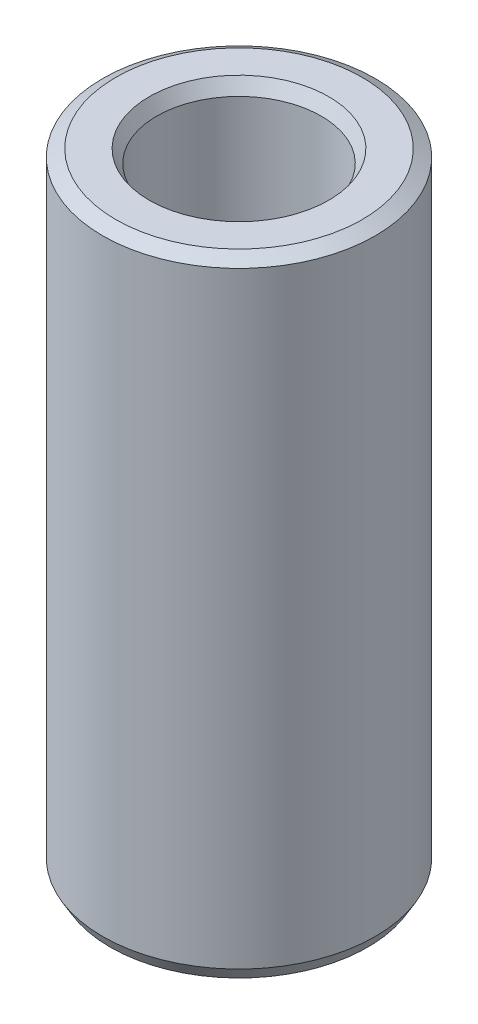
from build123d import *
from OCP.BRepFilletAPI import BRepFilletAPI_MakeChamfer

# Parameters (mm, degrees)
SKETCH1_R           = 50
BOSS_EXTRUDE1_DEPTH = 230.191908905
SKETCH2_R           = 30.174089752
CUT_EXTRUDE1_DEPTH  = 241.807630538
CHAMFER1_SIZE       = 2.76422924
CHAMFER1_SIZE2      = 4.787785487


with BuildPart() as part:
    # Sketch1 → Boss-Extrude1 (new body)
    with BuildSketch(Plane(origin=(0, 0, 0), x_dir=(1, 0, 0), z_dir=(0, 1, 0))):
        Circle(SKETCH1_R)
    extrude(amount=BOSS_EXTRUDE1_DEPTH)

    # Sketch2 → Cut-Extrude1 (cut, through all)
    with BuildSketch(Plane(origin=(0, 0, 0), x_dir=(1, 0, 0), z_dir=(0, 1, 0))):
        Circle(SKETCH2_R)
    extrude(amount=CUT_EXTRUDE1_DEPTH, mode=Mode.SUBTRACT)

    # Chamfer1: one chamfer whose edges measure the first distance from different faces: ONE call of the kernel's chamfer builder (chamfer() names one face for all edges)
    chamfer1_edges_1 = [part.edges().sort_by_distance(p)[0] for p in [
        (-30.174089752, 230.191908905, 0),
    ]]
    chamfer1_side_1 = [part.faces().sort_by_distance(p)[0] for p in [
        (-48.585786438, 230.191908905, 0),
    ]]
    chamfer1_edges_2 = [part.edges().sort_by_distance(p)[0] for p in [
        (-30.174089752, 0, 0),
    ]]
    chamfer1_side_2 = [part.faces().sort_by_distance(p)[0] for p in [
        (-30.174089752, 115.095954452, 0),
    ]]
    chamfer1_edges_3 = [part.edges().sort_by_distance(p)[0] for p in [
        (-50, 0, 0),
    ]]
    chamfer1_side_3 = [part.faces().sort_by_distance(p)[0] for p in [
        (-48.585786438, 0, 0),
    ]]
    chamfer1_edges_4 = [part.edges().sort_by_distance(p)[0] for p in [
        (-50, 230.191908905, 0),
    ]]
    chamfer1_side_4 = [part.faces().sort_by_distance(p)[0] for p in [
        (-50, 115.095954452, 0),
    ]]
    chamfer1 = BRepFilletAPI_MakeChamfer(part.part.solid().wrapped)
    for e in chamfer1_edges_1:
        chamfer1.Add(CHAMFER1_SIZE, CHAMFER1_SIZE2, e.wrapped, chamfer1_side_1[0].wrapped)  # the first distance lies on this face
    for e in chamfer1_edges_2:
        chamfer1.Add(CHAMFER1_SIZE, CHAMFER1_SIZE2, e.wrapped, chamfer1_side_2[0].wrapped)  # the first distance lies on this face
    for e in chamfer1_edges_3:
        chamfer1.Add(CHAMFER1_SIZE, CHAMFER1_SIZE2, e.wrapped, chamfer1_side_3[0].wrapped)  # the first distance lies on this face
    for e in chamfer1_edges_4:
        chamfer1.Add(CHAMFER1_SIZE, CHAMFER1_SIZE2, e.wrapped, chamfer1_side_4[0].wrapped)  # the first distance lies on this face
    add(Compound.cast(chamfer1.Shape()), mode=Mode.REPLACE)


solid = part.part
